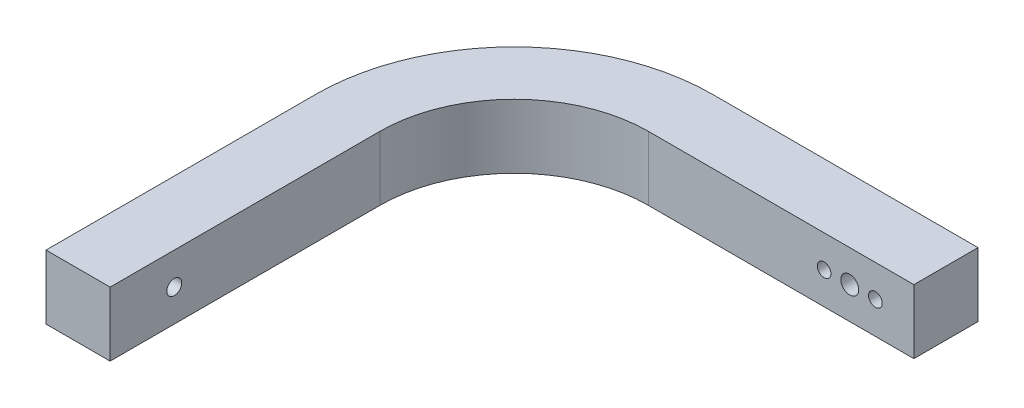
from build123d import *

# Parameters (mm, degrees)
BOSS_EXTRUDE1_DEPTH      = 7.5
BOSS_EXTRUDE1_DEPTH_BACK = 7.5
CUT_EXTRUDE1_DEPTH       = 145.183043386
CUT_EXTRUDE1_DEPTH_BACK  = 145.183043386
SKETCH2_R                = 1.75
SKETCH3_R                = 2.1
SKETCH3_R_2              = 1.6
CUT_EXTRUDE2_DEPTH       = 145.183043386
SKETCH4_R                = 2.275
CUT_EXTRUDE3_DEPTH       = 6
SKETCH5_R                = 3.825
CUT_EXTRUDE4_DEPTH       = 0.75


with BuildPart() as part:
    # Sketch1 → Boss-Extrude1 (new, two sides: drawn at the far end of the back side and taken through both)
    with BuildSketch(Plane(origin=(0, 0, 0), x_dir=(1, 0, 0), z_dir=(0, 1, 0)).offset(-BOSS_EXTRUDE1_DEPTH_BACK)):
        with BuildLine():
            Line((-93.5, -46.4), (-93.5, -109.5))
            Line((-93.5, -109.5), (-78.5, -109.5))
            Line((-78.5, -109.5), (-78.5, -46.4))
            ThreePointArc((-78.5, -46.4), (-69.303152929, -24.196847071), (-47.1, -15))
            Line((-47.1, -15), (15, -15))
            Line((15, -15), (15, 0))
            Line((15, 0), (-47.1, 0))
            ThreePointArc((-47.1, 0), (-79.909754647, -13.590245353), (-93.5, -46.4))
        make_face()
    extrude(amount=BOSS_EXTRUDE1_DEPTH + BOSS_EXTRUDE1_DEPTH_BACK)

    # Sketch2 → Cut-Extrude1 (cut, two sides: drawn at the far end of the back side and taken through both)
    with BuildSketch(Plane.ZY.offset(78.5).offset(-CUT_EXTRUDE1_DEPTH_BACK)):
        with Locations((94.5, 0)):
            Circle(SKETCH2_R)
    extrude(amount=CUT_EXTRUDE1_DEPTH + CUT_EXTRUDE1_DEPTH_BACK, mode=Mode.SUBTRACT)

    # Sketch3 → Cut-Extrude2 (cut, through all)
    with BuildSketch(Plane(origin=(0, 0, 0), x_dir=(-1, 0, 0), z_dir=(0, 0, -1))):
        Circle(SKETCH3_R)
        with Locations((-6, 0)):
            Circle(SKETCH3_R_2)
        with Locations((6, 0)):
            Circle(SKETCH3_R_2)
    extrude(amount=-CUT_EXTRUDE2_DEPTH, mode=Mode.SUBTRACT)

    # Sketch4 → Cut-Extrude3 (cut)
    with BuildSketch(Plane(origin=(-93.5, 0, 0), x_dir=(0, 0, -1), z_dir=(1, 0, 0))):
        with Locations((-94.5, 0)):
            Circle(SKETCH4_R)
    extrude(amount=CUT_EXTRUDE3_DEPTH, mode=Mode.SUBTRACT)

    # Sketch5 → Cut-Extrude4 (cut)
    with BuildSketch(Plane.ZY.offset(93.5)):
        with Locations((94.5, 0)):
            Circle(SKETCH5_R)
    extrude(amount=-CUT_EXTRUDE4_DEPTH, mode=Mode.SUBTRACT)


solid = part.part
